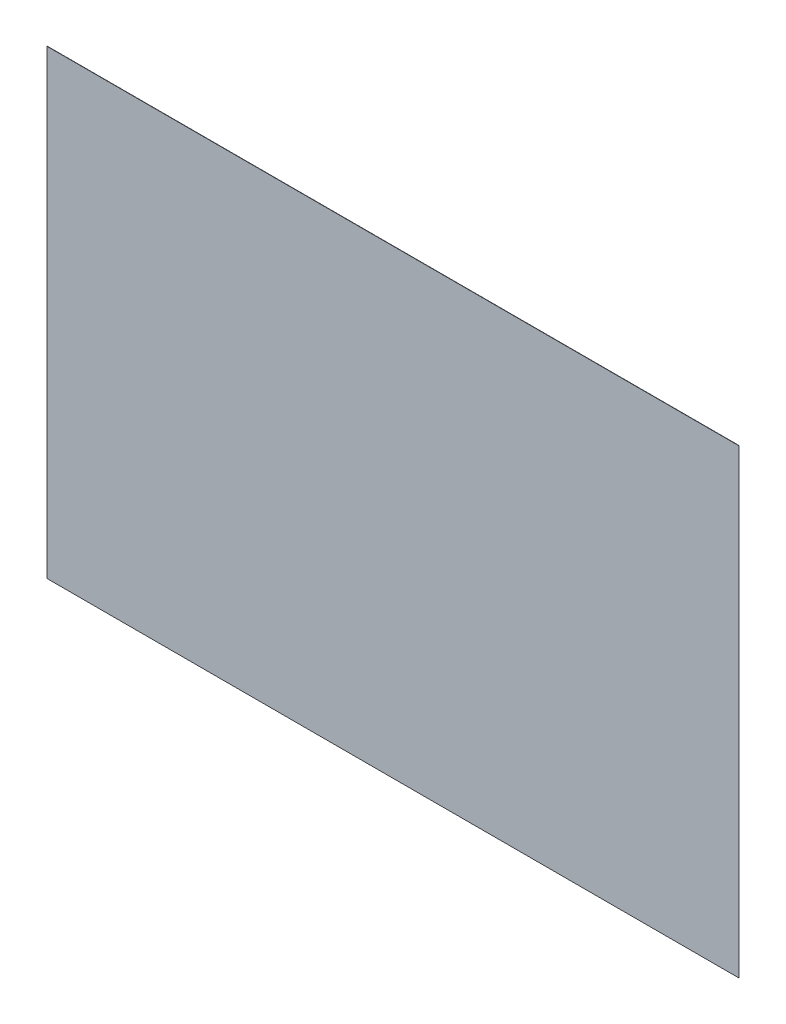
from build123d import *

# Parameters (mm, degrees)
SKETCH1_W           = 2440
SKETCH1_H           = 1625
BOSS_EXTRUDE1_DEPTH = 1


with BuildPart() as part:
    # Sketch1 → Boss-Extrude1 (new body)
    with BuildSketch(Plane.XY):
        with Locations((1220, 812.5)):
            Rectangle(SKETCH1_W, SKETCH1_H)
    extrude(amount=BOSS_EXTRUDE1_DEPTH)


solid = part.part
